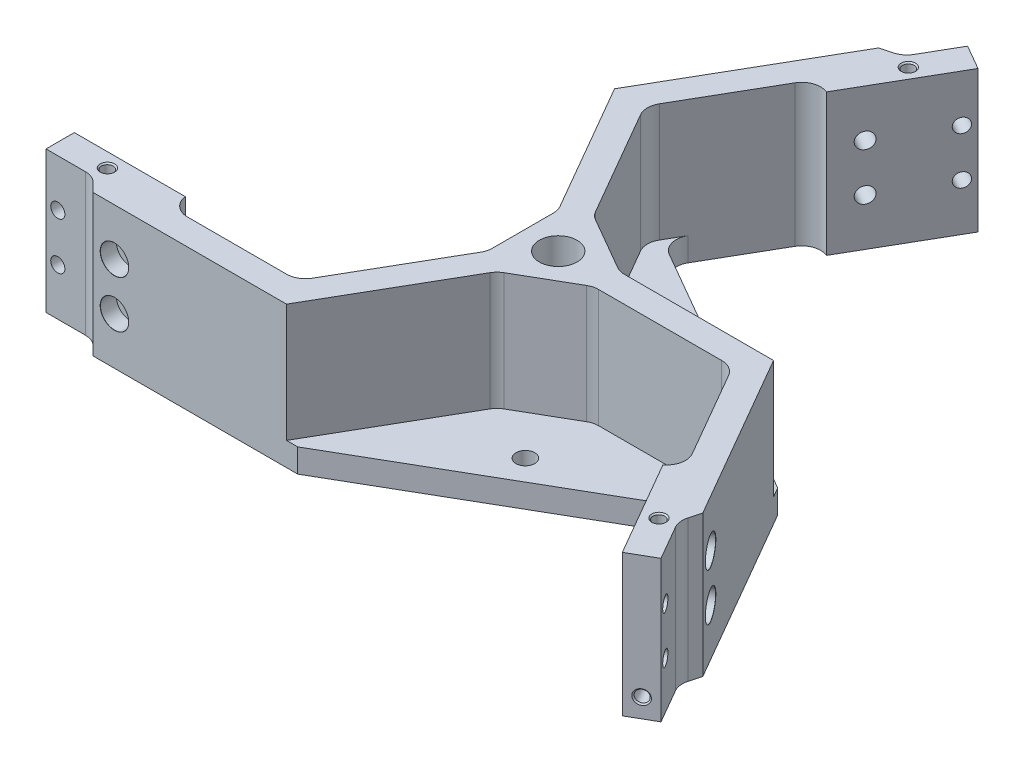
from build123d import *

# Parameters (mm, degrees)
EXTRUDE_1_DEPTH                = 15
SKETCH_3_R                     = 4
CUT_EXTRUDE_2_DEPTH            = 114.071293147
CUT_EXTRUDE_3_DEPTH            = 114.071293147
CUT_EXTRUDE_5_DEPTH            = 25
HOLE_WIZARD_0_AT_2_COUNT       = 2
HOLE_WIZARD_0_AT_2_PITCH       = 10
CUT_EXTRUDE_8_REACH            = 142.809
SKETCH_8_R                     = 1.5
PATTERN_START                  = 29.5
PATTERN_CIRCULAR_3_OUTLINE_R   = 1.5
PATTERN_CIRCULAR_3_DEPTH       = 6
PATTERN_START_2                = -35.5
PATTERN_CIRCULAR_3_2_OUTLINE_R = 1.5
PATTERN_CIRCULAR_3_2_DEPTH     = 6
SKETCH_5_R                     = 2
CUT_EXTRUDE_6_DEPTH            = 114.071293147
FILLET_1_R                     = 4


# Read off the part's stored shape, not the designer's step: 阵列(圆周)3
with BuildPart() as part:
    # 草图1 → 凸台-拉伸1 (new, symmetric)
    with BuildSketch(Plane(origin=(0, 0, 0), x_dir=(1, 0, 0), z_dir=(0, 1, 0))):
        Polygon((-73, -29.5), (-49.5, -29.5), (-49.5, -33), (-25, -33), (-25, 33), (-49.5, 33), (-49.5, 29.5), (-73, 29.5), (-73, 35.5), (-33.621950917, 58.234927238), (5.756098166, 80.969854476), (10.952250588, 77.969854476), (-0.797749412, 57.618257487), (-3.828838325, 59.368257487), (-16.078838325, 38.150635095), (41.078838325, 5.150635095), (53.328838325, 26.368257487), (50.297749412, 28.118257487), (62.047749412, 48.469854476), (67.243901834, 45.469854476), (67.243901834, 0), (67.243901834, -45.469854476), (62.047749412, -48.469854476), (50.297749412, -28.118257487), (53.328838325, -26.368257487), (41.078838325, -5.150635095), (-16.078838325, -38.150635095), (-3.828838325, -59.368257487), (-0.797749412, -57.618257487), (10.952250588, -77.969854476), (5.756098166, -80.969854476), (-33.621950917, -58.234927238), (-73, -35.5), align=None)
    extrude(amount=EXTRUDE_1_DEPTH, both=True)

    # 草图3 → 切除-拉伸2 (cut, through all)
    with BuildSketch(Plane(origin=(0, 15, 0), x_dir=(1, 0, 0), z_dir=(0, 1, 0))):
        with Locations(Location((0, 0, 0), (0, 0, 270))):
            Circle(SKETCH_3_R)
    extrude(amount=-CUT_EXTRUDE_2_DEPTH, mode=Mode.SUBTRACT)

    # 草图4 → 切除-拉伸3 (cut, through all)
    with BuildSketch(Plane(origin=(0, 15, 0), x_dir=(1, 0, 0), z_dir=(0, 1, 0))):
        Polygon((67.243901834, 45.469854476), (67.243901834, -45.469854476), (62.243901834, -36.809600438), (63.341978046, -32.711524227), (41.683956091, 4.801270189), (38.047749412, 6.900635095), (62.047749412, 48.469854476), align=None)
        Polygon((-73, 35.5), (5.756098166, 80.969854476), (0.756098166, 72.309600438), (-3.341978046, 71.211524227), (-25, 33.698729811), (-25, 29.5), (-73, 29.5), align=None)
        Polygon((5.756098166, -80.969854476), (-73, -35.5), (-63, -35.5), (-60, -38.5), (-16.683956091, -38.5), (-13.047749412, -36.400635095), (10.952250588, -77.969854476), align=None)
    extrude(amount=-CUT_EXTRUDE_3_DEPTH, mode=Mode.SUBTRACT)

    # 草图7 → 切除-拉伸5 (cut)
    with BuildSketch(Plane(origin=(0, 15, 0), x_dir=(1, 0, 0), z_dir=(0, 1, 0))):
        Polygon((-17.464845643, 35.75), (-2.736860279, 10.240381057), (10.236860279, 2.75), (42.868257487, 2.75), (24.183956091, 35.112159322), (-7.328838325, 53.306079661), align=None)
        Polygon((39.692831007, -2.75), (49.828838325, -20.306079661), (18.316043909, -38.5), (-19.052558883, -38.5), (-2.736860279, -10.240381057), (10.236860279, -2.75), align=None)
        Polygon((-22.227985364, -33), (-42.5, -33), (-42.5, 3.387840678), (-23.815698604, 35.75), (-7.5, 7.490381057), (-7.5, -7.490381057), align=None)
    extrude(amount=-CUT_EXTRUDE_5_DEPTH, mode=Mode.SUBTRACT)

    # 草图9 → 打孔尺寸(%根据)内六角圆柱头螺钉的类型0 (revolve, cut)
    with BuildSketch(Plane(origin=(-55.5, 5, 38.5), x_dir=(0, -1, 0), z_dir=(1, 0, 0))):
        Polygon((0, 0), (0, 142.204781714), (1.7, 142.204781714), (1.7, 3.4), (3, 3.4), (3, 0.025), (3.025, 0), align=None)
    hole_wizard_0 = revolve(axis=Axis((-55.5, 5, 44.85), (0, 0, -1)), mode=Mode.SUBTRACT)

    # 打孔尺寸(%根据)内六角圆柱头螺钉的类型0 at 2: 打孔尺寸(%根据)内六角圆柱头螺钉的类型0 ×2
    with Locations(*[(0, -i * HOLE_WIZARD_0_AT_2_PITCH, 0) for i in range(1, HOLE_WIZARD_0_AT_2_COUNT)]):
        add(hole_wizard_0, mode=Mode.SUBTRACT)

    # 镜向1: 打孔尺寸(%根据)内六角圆柱头螺钉的类型0 across plane
    add(hole_wizard_0.mirror(Plane.XY), mode=Mode.SUBTRACT)

    # 镜向1 copy 1 sketch → 镜向1 copy 1 (revolve, cut)
    with BuildSketch(Plane(origin=(-55.5, -5, -38.5), x_dir=(0, -1, 0), z_dir=(1, 0, 0))):
        Polygon((0, 0), (0, -142.204781714), (1.7, -142.204781714), (1.7, -3.4), (3, -3.4), (3, -0.025), (3.025, 0), align=None)
    revolve(axis=Axis((-55.5, -5, -44.85), (0, 0, -1)), mode=Mode.SUBTRACT)

    # 草图8 → 切除-拉伸8 (cut, up to next)
    with BuildSketch(Plane.XY.offset(38.5), mode=Mode.PRIVATE) as cut_extrude_8_sk1:
        with Locations((-70.5, 5)):
            Circle(SKETCH_8_R)
    cut_extrude_8_tool1 = extrude(cut_extrude_8_sk1.sketch, amount=-CUT_EXTRUDE_8_REACH, mode=Mode.PRIVATE) & part.part
    # 草图8 → 切除-拉伸8 (cut, up to next)
    with BuildSketch(Plane.XY.offset(38.5), mode=Mode.PRIVATE) as cut_extrude_8_sk2:
        with Locations((-70.5, -5)):
            Circle(SKETCH_8_R)
    cut_extrude_8_tool2 = extrude(cut_extrude_8_sk2.sketch, amount=-CUT_EXTRUDE_8_REACH, mode=Mode.PRIVATE) & part.part
    add(cut_extrude_8_tool1.solids().sort_by_distance((-70.5, 5, 38.5))[0], mode=Mode.SUBTRACT)
    add(cut_extrude_8_tool2.solids().sort_by_distance((-70.5, -5, 38.5))[0], mode=Mode.SUBTRACT)

    # 草图12 → M3 螺纹孔1 (revolve, cut)
    with BuildSketch(Plane(origin=(-73, -11, 32.5), x_dir=(0, 0, 1), z_dir=(0, 1, 0))):
        Polygon((0, 0), (0, 9.251075774), (1.25, 8.5), (1.25, 0.275), (1.525, 0), align=None)
    revolve(axis=Axis((-79.35, -11, 32.5), (1, 0, 0)), mode=Mode.SUBTRACT)

    # 草图12 at point 2 (carried to point 2, square into its face) → M3 螺纹孔1 at 2 (revolve, cut)
    with BuildSketch(Plane(origin=(-63, 15, 32.5), x_dir=(0, 0, 1), z_dir=(1, 0, 0))):
        Polygon((0, 0), (0, 9.251075774), (1.25, 8.5), (1.25, 0.275), (1.525, 0), align=None)
    revolve(axis=Axis((-63, 21.35, 32.5), (0, -1, 0)), mode=Mode.SUBTRACT)

    # 阵列(圆周)3 outline → 阵列(圆周)3 (cut)
    with BuildSketch(Plane(origin=(0, 0, 0), x_dir=(0.500000000000004, 0, 0.8660254037844363), z_dir=(0.8660254037844363, 0, -0.5000000000000042)).offset(PATTERN_START)):
        with Locations((70.5, -5)):
            Circle(PATTERN_CIRCULAR_3_OUTLINE_R)
        with Locations((70.5, 5)):
            Circle(PATTERN_CIRCULAR_3_OUTLINE_R)
    extrude(amount=PATTERN_CIRCULAR_3_DEPTH, mode=Mode.SUBTRACT)

    # Pattern Circular 3 2 outline → Pattern Circular 3 2 (cut)
    with BuildSketch(Plane(origin=(0, 0, 0), x_dir=(0.49999999999999195, 0, -0.8660254037844434), z_dir=(0.8660254037844433, 0, 0.4999999999999921)).offset(PATTERN_START_2)):
        with Locations((70.5, -5)):
            Circle(PATTERN_CIRCULAR_3_2_OUTLINE_R)
        with Locations((70.5, 5)):
            Circle(PATTERN_CIRCULAR_3_2_OUTLINE_R)
    extrude(amount=PATTERN_CIRCULAR_3_2_DEPTH, mode=Mode.SUBTRACT)

    # Pattern Circular 3 3 outline → Pattern Circular 3 3 (revolve, cut)
    with BuildSketch(Plane(origin=(27.75, -5, 48.06440991), x_dir=(0.500000000000004, 0, 0.8660254037844363), z_dir=(0, 1, 0))):
        Polygon((0, 29.5), (1.7, 29.5), (1.7, 35.1), (3, 35.1), (3, 38.475), (3.025, 38.5), (0, 38.5), align=None)
    revolve(axis=Axis((27.75, -5, 48.06440991), (0.8660254037844363, 0, -0.500000000000004)), mode=Mode.SUBTRACT)

    # Pattern Circular 3 4 outline → Pattern Circular 3 4 (revolve, cut)
    with BuildSketch(Plane(origin=(27.75, 5, 48.06440991), x_dir=(0.500000000000004, 0, 0.8660254037844363), z_dir=(0, 1, 0))):
        Polygon((0, 38.5), (0, 29.5), (1.7, 29.5), (1.7, 35.1), (3, 35.1), (3, 38.475), (3.025, 38.5), align=None)
    revolve(axis=Axis((27.75, 5, 48.06440991), (0.8660254037844363, 0, -0.500000000000004)), mode=Mode.SUBTRACT)

    # Pattern Circular 3 5 outline → Pattern Circular 3 5 (revolve, cut)
    with BuildSketch(Plane(origin=(27.75, -5, -48.06440991), x_dir=(0.49999999999999195, 0, -0.8660254037844434), z_dir=(0, -1, 0))):
        Polygon((1.7, -35.1), (1.7, -29.5), (0, -29.5), (0, -38.5), (3.025, -38.5), (3, -38.475), (3, -35.1), align=None)
    revolve(axis=Axis((27.75, -5, -48.06440991), (0.8660254037844436, 0, 0.49999999999999206)), mode=Mode.SUBTRACT)

    # Pattern Circular 3 6 outline → Pattern Circular 3 6 (revolve, cut)
    with BuildSketch(Plane(origin=(27.75, 5, -48.06440991), x_dir=(0.49999999999999195, 0, -0.8660254037844434), z_dir=(0, -1, 0))):
        Polygon((0, -38.5), (3.025, -38.5), (3, -38.475), (3, -35.1), (1.7, -35.1), (1.7, -29.5), (0, -29.5), align=None)
    revolve(axis=Axis((27.75, 5, -48.06440991), (0.8660254037844436, 0, 0.49999999999999206)), mode=Mode.SUBTRACT)

    # Pattern Circular 3 7 outline → Pattern Circular 3 7 (revolve, cut)
    with BuildSketch(Plane(origin=(59.645825623, 0, 38.309600438), x_dir=(1, 0, 0), z_dir=(0, 0, 1))):
        Polygon((0, 15), (0, 5.748924226), (1.25, 6.5), (1.25, 14.725), (1.525, 15), align=None)
    revolve(axis=Axis((59.645825623, 0, 38.309600438), (0, 1, 0)), mode=Mode.SUBTRACT)

    # Pattern Circular 3 8 outline → Pattern Circular 3 8 (revolve, cut)
    with BuildSketch(Plane(origin=(28.145825623, -11, -16.25), x_dir=(0.8660254037844362, 0, -0.5000000000000042), z_dir=(0, -1, 0))):
        Polygon((0, 73), (0, 63.748924226), (1.25, 64.5), (1.25, 72.725), (1.525, 73), align=None)
    revolve(axis=Axis((28.145825623, -11, -16.25), (0.5000000000000042, 0, 0.8660254037844362)), mode=Mode.SUBTRACT)

    # Pattern Circular 3 9 outline → Pattern Circular 3 9 (revolve, cut)
    with BuildSketch(Plane(origin=(3.354174377, 0, -70.809600438), x_dir=(1, 0, 0), z_dir=(0, 0, 1))):
        Polygon((0, 15), (0, 5.748924226), (1.25, 6.5), (1.25, 14.725), (1.525, 15), align=None)
    revolve(axis=Axis((3.354174377, 0, -70.809600438), (0, 1, 0)), mode=Mode.SUBTRACT)

    # Pattern Circular 3 10 outline → Pattern Circular 3 10 (revolve, cut)
    with BuildSketch(Plane(origin=(-28.145825623, -11, -16.25), x_dir=(0.8660254037844431, 0, 0.4999999999999921), z_dir=(0, 1, 0))):
        Polygon((0, 73), (0, 63.748924226), (1.25, 64.5), (1.25, 72.725), (1.525, 73), align=None)
    revolve(axis=Axis((-28.145825623, -11, -16.25), (0.4999999999999921, 0, -0.8660254037844431)), mode=Mode.SUBTRACT)

    # 草图5 → 切除-拉伸6 (cut, through all)
    with BuildSketch(Plane(origin=(0, 15, 0), x_dir=(1, 0, 0), z_dir=(0, 1, 0))):
        with Locations(Location((9.5, -16.454482672, 0), (0, 0, 270))):
            Circle(SKETCH_5_R)
        with Locations(Location((9.5, 16.454482672, 0), (0, 0, 270))):
            Circle(SKETCH_5_R)
        with Locations(Location((-19, 0, 0), (0, 0, 270))):
            Circle(SKETCH_5_R)
    extrude(amount=-CUT_EXTRUDE_6_DEPTH, mode=Mode.SUBTRACT)

    # 圆角1
    # the kernel refuses this fillet: 4 mm, written as the material it adds along each edge
    with BuildSketch(Plane(origin=(10.236860279, 15, -2.75), x_dir=(1, 0, 0), z_dir=(0, -1, 0)), Plane(origin=(-2.736860279, 15, -10.240381057), x_dir=(0.8660254037844394, 0, 0.4999999999999988), z_dir=(0, -1, 0)), Plane(origin=(10.236860279, 15, 2.75), x_dir=(-0.8660254037844378, 0, 0.5000000000000013), z_dir=(0, -1, 0)), Plane(origin=(-2.736860279, 15, 10.240381057), x_dir=(-0.4999999999999994, 0, 0.8660254037844388), z_dir=(0, -1, 0))) as fillet_1_piece_1:
        with BuildLine():
            CenterArc((FILLET_1_R * 0.267949192431, -FILLET_1_R), FILLET_1_R, 90, 30)
            Line((-FILLET_1_R * 0.232050807569, -FILLET_1_R * 0.133974596216), (0, 0))
            Line((0, 0), (FILLET_1_R * 0.267949192431, 0))
        make_face()
    extrude(amount=27.679491924)
    with BuildSketch(Plane(origin=(-17.464845643, 15, -35.75), x_dir=(0.49999999999999695, 0, -0.8660254037844403), z_dir=(0, -1, 0)), Plane(origin=(39.692831007, 15, 2.75), x_dir=(0.499999999999998, 0, 0.8660254037844398), z_dir=(0, -1, 0)), Plane(origin=(-22.227985364, 15, 33), x_dir=(-1, 0, 0), z_dir=(0, -1, 0))) as fillet_1_piece_2:
        with BuildLine():
            CenterArc((FILLET_1_R * 0.57735026919, FILLET_1_R), FILLET_1_R, 210, 60)
            Line((-FILLET_1_R * 0.288675134595, FILLET_1_R * 0.5), (0, 0))
            Line((0, 0), (FILLET_1_R * 0.57735026919, 0))
        make_face()
    extrude(amount=25)
    with BuildSketch(Plane(origin=(-16.078838325, -10, -38.150635095), x_dir=(0.4999999999999998, 0, -0.8660254037844389), z_dir=(0, -1, 0)), Plane(origin=(-25, -10, 33), x_dir=(-1, 0, 0), z_dir=(0, -1, 0))) as fillet_1_piece_3:
        with BuildLine():
            CenterArc((FILLET_1_R, FILLET_1_R), FILLET_1_R, 180, 90)
            Line((0, FILLET_1_R), (0, 0))
            Line((0, 0), (FILLET_1_R, 0))
        make_face()
    extrude(amount=5)
    with BuildSketch(Plane(origin=(41.078838325, -10, 5.150635095), x_dir=(-0.8660254037844596, 0, 0.4999999999999637), z_dir=(0, -1, 0))) as fillet_1_piece_4:
        with BuildLine():
            CenterArc((FILLET_1_R, -FILLET_1_R), FILLET_1_R, 90, 90)
            Line((0, -FILLET_1_R), (0, 0))
            Line((0, 0), (FILLET_1_R, 0))
        make_face()
    extrude(amount=5)
    with BuildSketch(Plane(origin=(-7.5, 15, 7.490381057), x_dir=(-0.5000000000000009, 0, 0.8660254037844382), z_dir=(0, -1, 0)), Plane(origin=(-7.5, 15, -7.490381057), x_dir=(0, 0, 1), z_dir=(0, -1, 0))) as fillet_1_piece_5:
        with BuildLine():
            CenterArc((FILLET_1_R * 0.267949192431, FILLET_1_R), FILLET_1_R, 240, 30)
            Line((-FILLET_1_R * 0.232050807569, FILLET_1_R * 0.133974596216), (0, 0))
            Line((0, 0), (FILLET_1_R * 0.267949192431, 0))
        make_face()
    extrude(amount=27.679491924)
    with BuildSketch(Plane(origin=(-3.828838325, 15, -59.368257487), x_dir=(0.8660254037844386, 0, 0.5000000000000003), z_dir=(0, -1, 0)), Plane(origin=(-49.5, 15, 33), x_dir=(0, 0, -1), z_dir=(0, -1, 0))) as fillet_1_piece_6:
        with BuildLine():
            CenterArc((4, 3.968626967), FILLET_1_R, 180, 82.819244219)
            Line((0, 3.968626967), (0, 0))
            Line((0, 0), (3.5, 0))
        make_face()
    extrude(amount=30)
    with BuildSketch(Plane(origin=(0.756098166, 15, -72.309600438), x_dir=(-0.9659258262890686, 0, 0.2588190451025195), z_dir=(0, -1, 0))) as fillet_1_piece_7:
        with BuildLine():
            CenterArc((FILLET_1_R * 0.414213562373, FILLET_1_R), FILLET_1_R, 225, 45)
            Line((-FILLET_1_R * 0.292893218813, FILLET_1_R * 0.292893218813), (0, 0))
            Line((0, 0), (FILLET_1_R * 0.414213562373, 0))
        make_face()
    extrude(amount=30)
    with BuildSketch(Plane(origin=(62.243901834, 15, 36.809600438), x_dir=(0.4999999999999978, 0, 0.8660254037844399), z_dir=(0, -1, 0)), Plane(origin=(-63, 15, 35.5), x_dir=(-1, 0, 0), z_dir=(0, -1, 0))) as fillet_1_piece_8:
        with BuildLine():
            CenterArc((FILLET_1_R * 0.414213562373, -FILLET_1_R), FILLET_1_R, 90, 45)
            Line((-FILLET_1_R * 0.292893218813, -FILLET_1_R * 0.292893218813), (0, 0))
            Line((0, 0), (FILLET_1_R * 0.414213562373, 0))
        make_face()
    extrude(amount=30)
    with BuildSketch(Plane(origin=(53.328838325, 15, 26.368257487), x_dir=(-0.5000000000000001, 0, -0.8660254037844386), z_dir=(0, -1, 0))) as fillet_1_piece_9:
        with BuildLine():
            CenterArc((3.968626967, -4), FILLET_1_R, 90, 82.819244219)
            Line((0, -3.5), (0, 0))
            Line((0, 0), (3.968626967, 0))
        make_face()
    extrude(amount=30)


solid = part.part
